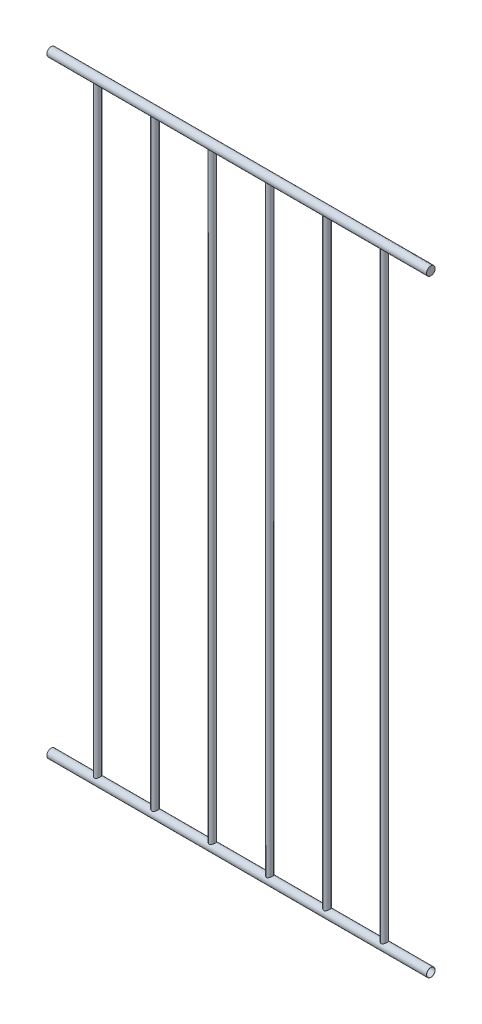
from build123d import *

# Parameters (mm, degrees)
SKETCH2_R                            = 11.45
BOSS_EXTRUDE1_DEPTH                  = 1000
BOSS_EXTRUDE1_2_DEPTH                = 1000
SKETCH3_R                            = 11
CUT_EXTRUDE1_DEPTH                   = 1000
BOSS_EXTRUDE3_REACH                  = 1289.867
BOSS_EXTRUDE3_END_RADIUS             = 11.45
SKETCH6_R                            = 8.072106602
BOSS_EXTRUDE3_DIRECTION_2_REACH      = 1289.867
BOSS_EXTRUDE3_DIRECTION_2_END_RADIUS = 11.45
BOSS_EXTRUDE4_REACH                  = 1289.867
SKETCH7_R                            = 7.5
BOSS_EXTRUDE4_DIRECTION_2_REACH      = 1289.867
SKETCH8_R                            = 11
CUT_EXTRUDE2_DEPTH                   = 1897.560736077
CUT_EXTRUDE4_REACH                   = 1289.867
SKETCH9_R                            = 7.5
CUT_EXTRUDE4_DIRECTION_2_REACH       = 1289.867
SKETCH10_R                           = 11
BOSS_EXTRUDE5_DEPTH                  = 2
SKETCH11_R                           = 11
BOSS_EXTRUDE6_DEPTH                  = 2


with BuildPart() as part:
    # Sketch2 → Boss-Extrude1 (new body)
    with BuildSketch(Plane(origin=(0, 0, 0), x_dir=(0, 0, -1), z_dir=(1, 0, 0))):
        Circle(SKETCH2_R)
    extrude(amount=BOSS_EXTRUDE1_DEPTH)


with BuildPart() as body_2:
    # Sketch2 → Boss-Extrude1 2 (new body)
    with BuildSketch(Plane(origin=(0, 0, 0), x_dir=(0, 0, -1), z_dir=(1, 0, 0))):
        with Locations((0, -1600.012541484)):
            Circle(SKETCH2_R)
    extrude(amount=BOSS_EXTRUDE1_2_DEPTH)


with BuildPart() as cut_extrude1_tool:
    # Sketch3 → Cut-Extrude1 (new body)
    with BuildSketch(Plane(origin=(0, 0, 0), x_dir=(0, 0, -1), z_dir=(1, 0, 0))):
        Circle(SKETCH3_R)
        with Locations((0, -1600)):
            Circle(SKETCH3_R)
    extrude(amount=CUT_EXTRUDE1_DEPTH)


with BuildPart() as part_1:
    add(part.part)

    # Cut-Extrude1: cut by cut_extrude1_tool
    add(cut_extrude1_tool.part, mode=Mode.SUBTRACT)



with BuildPart() as body_2_1:
    add(body_2.part)

    # Cut-Extrude1: cut by cut_extrude1_tool
    add(cut_extrude1_tool.part, mode=Mode.SUBTRACT)


with BuildPart() as part_2:
    add(part_1.part)

    add(body_2_1.part)  # Boss-Extrude3 merges body 2
    # Boss-Extrude3: up to this cylinder (the profile starts outside it)
    boss_extrude3_end = Plane(origin=(500, -1600.012541484, 0), z_dir=(-1, 0, 0)) * Cylinder(BOSS_EXTRUDE3_END_RADIUS, 3358.634, mode=Mode.PRIVATE)
    # Sketch6 → Boss-Extrude3 (add, up to the surface)
    with BuildSketch(Plane(origin=(0, -800, 0), x_dir=(-1, 0, 0), z_dir=(0, -1, 0)), mode=Mode.PRIVATE) as boss_extrude3_sk1:
        with Locations((-122.5, 0)):
            Circle(SKETCH6_R)
    boss_extrude3_tool1 = extrude(boss_extrude3_sk1.sketch, amount=BOSS_EXTRUDE3_REACH, mode=Mode.PRIVATE) - boss_extrude3_end
    add(boss_extrude3_tool1.solids().sort_by_distance((122.5, -800, 0))[0])
    # Sketch6 → Boss-Extrude3 (add, up to the surface)
    with BuildSketch(Plane(origin=(0, -800, 0), x_dir=(-1, 0, 0), z_dir=(0, -1, 0)), mode=Mode.PRIVATE) as boss_extrude3_sk2:
        with Locations((-273.5, 0)):
            Circle(SKETCH6_R)
    boss_extrude3_tool2 = extrude(boss_extrude3_sk2.sketch, amount=BOSS_EXTRUDE3_REACH, mode=Mode.PRIVATE) - boss_extrude3_end
    add(boss_extrude3_tool2.solids().sort_by_distance((273.5, -800, 0))[0])
    # Sketch6 → Boss-Extrude3 (add, up to the surface)
    with BuildSketch(Plane(origin=(0, -800, 0), x_dir=(-1, 0, 0), z_dir=(0, -1, 0)), mode=Mode.PRIVATE) as boss_extrude3_sk3:
        with Locations((-424.5, 0)):
            Circle(SKETCH6_R)
    boss_extrude3_tool3 = extrude(boss_extrude3_sk3.sketch, amount=BOSS_EXTRUDE3_REACH, mode=Mode.PRIVATE) - boss_extrude3_end
    add(boss_extrude3_tool3.solids().sort_by_distance((424.5, -800, 0))[0])
    # Sketch6 → Boss-Extrude3 (add, up to the surface)
    with BuildSketch(Plane(origin=(0, -800, 0), x_dir=(-1, 0, 0), z_dir=(0, -1, 0)), mode=Mode.PRIVATE) as boss_extrude3_sk4:
        with Locations((-575.5, 0)):
            Circle(SKETCH6_R)
    boss_extrude3_tool4 = extrude(boss_extrude3_sk4.sketch, amount=BOSS_EXTRUDE3_REACH, mode=Mode.PRIVATE) - boss_extrude3_end
    add(boss_extrude3_tool4.solids().sort_by_distance((575.5, -800, 0))[0])
    # Sketch6 → Boss-Extrude3 (add, up to the surface)
    with BuildSketch(Plane(origin=(0, -800, 0), x_dir=(-1, 0, 0), z_dir=(0, -1, 0)), mode=Mode.PRIVATE) as boss_extrude3_sk5:
        with Locations((-726.5, 0)):
            Circle(SKETCH6_R)
    boss_extrude3_tool5 = extrude(boss_extrude3_sk5.sketch, amount=BOSS_EXTRUDE3_REACH, mode=Mode.PRIVATE) - boss_extrude3_end
    add(boss_extrude3_tool5.solids().sort_by_distance((726.5, -800, 0))[0])
    # Sketch6 → Boss-Extrude3 (add, up to the surface)
    with BuildSketch(Plane(origin=(0, -800, 0), x_dir=(-1, 0, 0), z_dir=(0, -1, 0)), mode=Mode.PRIVATE) as boss_extrude3_sk6:
        with Locations((-877.5, 0)):
            Circle(SKETCH6_R)
    boss_extrude3_tool6 = extrude(boss_extrude3_sk6.sketch, amount=BOSS_EXTRUDE3_REACH, mode=Mode.PRIVATE) - boss_extrude3_end
    add(boss_extrude3_tool6.solids().sort_by_distance((877.5, -800, 0))[0])

    # Boss-Extrude3 direction 2: up to this cylinder (the profile starts outside it)
    boss_extrude3_direction_2_end = Plane(origin=(500, 0, 0), z_dir=(-1, 0, 0)) * Cylinder(BOSS_EXTRUDE3_DIRECTION_2_END_RADIUS, 3358.634, mode=Mode.PRIVATE)
    # Sketch6 → Boss-Extrude3 direction 2 (add, up to the surface)
    with BuildSketch(Plane(origin=(0, -800, 0), x_dir=(-1, 0, 0), z_dir=(0, -1, 0)), mode=Mode.PRIVATE) as boss_extrude3_direction_2_sk1:
        with Locations((-122.5, 0)):
            Circle(SKETCH6_R)
    boss_extrude3_direction_2_tool1 = extrude(boss_extrude3_direction_2_sk1.sketch, amount=-BOSS_EXTRUDE3_DIRECTION_2_REACH, mode=Mode.PRIVATE) - boss_extrude3_direction_2_end
    add(boss_extrude3_direction_2_tool1.solids().sort_by_distance((122.5, -800, 0))[0])
    # Sketch6 → Boss-Extrude3 direction 2 (add, up to the surface)
    with BuildSketch(Plane(origin=(0, -800, 0), x_dir=(-1, 0, 0), z_dir=(0, -1, 0)), mode=Mode.PRIVATE) as boss_extrude3_direction_2_sk2:
        with Locations((-273.5, 0)):
            Circle(SKETCH6_R)
    boss_extrude3_direction_2_tool2 = extrude(boss_extrude3_direction_2_sk2.sketch, amount=-BOSS_EXTRUDE3_DIRECTION_2_REACH, mode=Mode.PRIVATE) - boss_extrude3_direction_2_end
    add(boss_extrude3_direction_2_tool2.solids().sort_by_distance((273.5, -800, 0))[0])
    # Sketch6 → Boss-Extrude3 direction 2 (add, up to the surface)
    with BuildSketch(Plane(origin=(0, -800, 0), x_dir=(-1, 0, 0), z_dir=(0, -1, 0)), mode=Mode.PRIVATE) as boss_extrude3_direction_2_sk3:
        with Locations((-424.5, 0)):
            Circle(SKETCH6_R)
    boss_extrude3_direction_2_tool3 = extrude(boss_extrude3_direction_2_sk3.sketch, amount=-BOSS_EXTRUDE3_DIRECTION_2_REACH, mode=Mode.PRIVATE) - boss_extrude3_direction_2_end
    add(boss_extrude3_direction_2_tool3.solids().sort_by_distance((424.5, -800, 0))[0])
    # Sketch6 → Boss-Extrude3 direction 2 (add, up to the surface)
    with BuildSketch(Plane(origin=(0, -800, 0), x_dir=(-1, 0, 0), z_dir=(0, -1, 0)), mode=Mode.PRIVATE) as boss_extrude3_direction_2_sk4:
        with Locations((-575.5, 0)):
            Circle(SKETCH6_R)
    boss_extrude3_direction_2_tool4 = extrude(boss_extrude3_direction_2_sk4.sketch, amount=-BOSS_EXTRUDE3_DIRECTION_2_REACH, mode=Mode.PRIVATE) - boss_extrude3_direction_2_end
    add(boss_extrude3_direction_2_tool4.solids().sort_by_distance((575.5, -800, 0))[0])
    # Sketch6 → Boss-Extrude3 direction 2 (add, up to the surface)
    with BuildSketch(Plane(origin=(0, -800, 0), x_dir=(-1, 0, 0), z_dir=(0, -1, 0)), mode=Mode.PRIVATE) as boss_extrude3_direction_2_sk5:
        with Locations((-726.5, 0)):
            Circle(SKETCH6_R)
    boss_extrude3_direction_2_tool5 = extrude(boss_extrude3_direction_2_sk5.sketch, amount=-BOSS_EXTRUDE3_DIRECTION_2_REACH, mode=Mode.PRIVATE) - boss_extrude3_direction_2_end
    add(boss_extrude3_direction_2_tool5.solids().sort_by_distance((726.5, -800, 0))[0])
    # Sketch6 → Boss-Extrude3 direction 2 (add, up to the surface)
    with BuildSketch(Plane(origin=(0, -800, 0), x_dir=(-1, 0, 0), z_dir=(0, -1, 0)), mode=Mode.PRIVATE) as boss_extrude3_direction_2_sk6:
        with Locations((-877.5, 0)):
            Circle(SKETCH6_R)
    boss_extrude3_direction_2_tool6 = extrude(boss_extrude3_direction_2_sk6.sketch, amount=-BOSS_EXTRUDE3_DIRECTION_2_REACH, mode=Mode.PRIVATE) - boss_extrude3_direction_2_end
    add(boss_extrude3_direction_2_tool6.solids().sort_by_distance((877.5, -800, 0))[0])

    # Sketch7 → Boss-Extrude4 (add, up to next)
    with BuildSketch(Plane(origin=(0, -800, 0), x_dir=(-1, 0, 0), z_dir=(0, -1, 0)), mode=Mode.PRIVATE) as boss_extrude4_sk1:
        with Locations((-122.5, 0)):
            Circle(SKETCH7_R)
    boss_extrude4_tool1 = extrude(boss_extrude4_sk1.sketch, amount=BOSS_EXTRUDE4_REACH, mode=Mode.PRIVATE) - part_2.part
    # Sketch7 → Boss-Extrude4 (add, up to next)
    with BuildSketch(Plane(origin=(0, -800, 0), x_dir=(-1, 0, 0), z_dir=(0, -1, 0)), mode=Mode.PRIVATE) as boss_extrude4_sk2:
        with Locations((-273.5, 0)):
            Circle(SKETCH7_R)
    boss_extrude4_tool2 = extrude(boss_extrude4_sk2.sketch, amount=BOSS_EXTRUDE4_REACH, mode=Mode.PRIVATE) - part_2.part
    # Sketch7 → Boss-Extrude4 (add, up to next)
    with BuildSketch(Plane(origin=(0, -800, 0), x_dir=(-1, 0, 0), z_dir=(0, -1, 0)), mode=Mode.PRIVATE) as boss_extrude4_sk3:
        with Locations((-424.5, 0)):
            Circle(SKETCH7_R)
    boss_extrude4_tool3 = extrude(boss_extrude4_sk3.sketch, amount=BOSS_EXTRUDE4_REACH, mode=Mode.PRIVATE) - part_2.part
    # Sketch7 → Boss-Extrude4 (add, up to next)
    with BuildSketch(Plane(origin=(0, -800, 0), x_dir=(-1, 0, 0), z_dir=(0, -1, 0)), mode=Mode.PRIVATE) as boss_extrude4_sk4:
        with Locations((-575.5, 0)):
            Circle(SKETCH7_R)
    boss_extrude4_tool4 = extrude(boss_extrude4_sk4.sketch, amount=BOSS_EXTRUDE4_REACH, mode=Mode.PRIVATE) - part_2.part
    # Sketch7 → Boss-Extrude4 (add, up to next)
    with BuildSketch(Plane(origin=(0, -800, 0), x_dir=(-1, 0, 0), z_dir=(0, -1, 0)), mode=Mode.PRIVATE) as boss_extrude4_sk5:
        with Locations((-726.5, 0)):
            Circle(SKETCH7_R)
    boss_extrude4_tool5 = extrude(boss_extrude4_sk5.sketch, amount=BOSS_EXTRUDE4_REACH, mode=Mode.PRIVATE) - part_2.part
    # Sketch7 → Boss-Extrude4 (add, up to next)
    with BuildSketch(Plane(origin=(0, -800, 0), x_dir=(-1, 0, 0), z_dir=(0, -1, 0)), mode=Mode.PRIVATE) as boss_extrude4_sk6:
        with Locations((-877.5, 0)):
            Circle(SKETCH7_R)
    boss_extrude4_tool6 = extrude(boss_extrude4_sk6.sketch, amount=BOSS_EXTRUDE4_REACH, mode=Mode.PRIVATE) - part_2.part
    add(boss_extrude4_tool1.solids().sort_by_distance((122.5, -800, 0))[0])
    add(boss_extrude4_tool2.solids().sort_by_distance((273.5, -800, 0))[0])
    add(boss_extrude4_tool3.solids().sort_by_distance((424.5, -800, 0))[0])
    add(boss_extrude4_tool4.solids().sort_by_distance((575.5, -800, 0))[0])
    add(boss_extrude4_tool5.solids().sort_by_distance((726.5, -800, 0))[0])
    add(boss_extrude4_tool6.solids().sort_by_distance((877.5, -800, 0))[0])

    # Sketch7 → Boss-Extrude4 direction 2 (add, up to next)
    with BuildSketch(Plane(origin=(0, -800, 0), x_dir=(-1, 0, 0), z_dir=(0, -1, 0)), mode=Mode.PRIVATE) as boss_extrude4_direction_2_sk1:
        with Locations((-122.5, 0)):
            Circle(SKETCH7_R)
    boss_extrude4_direction_2_tool1 = extrude(boss_extrude4_direction_2_sk1.sketch, amount=-BOSS_EXTRUDE4_DIRECTION_2_REACH, mode=Mode.PRIVATE) - part_2.part
    # Sketch7 → Boss-Extrude4 direction 2 (add, up to next)
    with BuildSketch(Plane(origin=(0, -800, 0), x_dir=(-1, 0, 0), z_dir=(0, -1, 0)), mode=Mode.PRIVATE) as boss_extrude4_direction_2_sk2:
        with Locations((-273.5, 0)):
            Circle(SKETCH7_R)
    boss_extrude4_direction_2_tool2 = extrude(boss_extrude4_direction_2_sk2.sketch, amount=-BOSS_EXTRUDE4_DIRECTION_2_REACH, mode=Mode.PRIVATE) - part_2.part
    # Sketch7 → Boss-Extrude4 direction 2 (add, up to next)
    with BuildSketch(Plane(origin=(0, -800, 0), x_dir=(-1, 0, 0), z_dir=(0, -1, 0)), mode=Mode.PRIVATE) as boss_extrude4_direction_2_sk3:
        with Locations((-424.5, 0)):
            Circle(SKETCH7_R)
    boss_extrude4_direction_2_tool3 = extrude(boss_extrude4_direction_2_sk3.sketch, amount=-BOSS_EXTRUDE4_DIRECTION_2_REACH, mode=Mode.PRIVATE) - part_2.part
    # Sketch7 → Boss-Extrude4 direction 2 (add, up to next)
    with BuildSketch(Plane(origin=(0, -800, 0), x_dir=(-1, 0, 0), z_dir=(0, -1, 0)), mode=Mode.PRIVATE) as boss_extrude4_direction_2_sk4:
        with Locations((-575.5, 0)):
            Circle(SKETCH7_R)
    boss_extrude4_direction_2_tool4 = extrude(boss_extrude4_direction_2_sk4.sketch, amount=-BOSS_EXTRUDE4_DIRECTION_2_REACH, mode=Mode.PRIVATE) - part_2.part
    # Sketch7 → Boss-Extrude4 direction 2 (add, up to next)
    with BuildSketch(Plane(origin=(0, -800, 0), x_dir=(-1, 0, 0), z_dir=(0, -1, 0)), mode=Mode.PRIVATE) as boss_extrude4_direction_2_sk5:
        with Locations((-726.5, 0)):
            Circle(SKETCH7_R)
    boss_extrude4_direction_2_tool5 = extrude(boss_extrude4_direction_2_sk5.sketch, amount=-BOSS_EXTRUDE4_DIRECTION_2_REACH, mode=Mode.PRIVATE) - part_2.part
    # Sketch7 → Boss-Extrude4 direction 2 (add, up to next)
    with BuildSketch(Plane(origin=(0, -800, 0), x_dir=(-1, 0, 0), z_dir=(0, -1, 0)), mode=Mode.PRIVATE) as boss_extrude4_direction_2_sk6:
        with Locations((-877.5, 0)):
            Circle(SKETCH7_R)
    boss_extrude4_direction_2_tool6 = extrude(boss_extrude4_direction_2_sk6.sketch, amount=-BOSS_EXTRUDE4_DIRECTION_2_REACH, mode=Mode.PRIVATE) - part_2.part
    add(boss_extrude4_direction_2_tool1.solids().sort_by_distance((122.5, -800, 0))[0])
    add(boss_extrude4_direction_2_tool2.solids().sort_by_distance((273.5, -800, 0))[0])
    add(boss_extrude4_direction_2_tool3.solids().sort_by_distance((424.5, -800, 0))[0])
    add(boss_extrude4_direction_2_tool4.solids().sort_by_distance((575.5, -800, 0))[0])
    add(boss_extrude4_direction_2_tool5.solids().sort_by_distance((726.5, -800, 0))[0])
    add(boss_extrude4_direction_2_tool6.solids().sort_by_distance((877.5, -800, 0))[0])

    # Sketch8 → Cut-Extrude2 (cut, through all)
    with BuildSketch(Plane(origin=(0, 0, 0), x_dir=(0, 0, -1), z_dir=(1, 0, 0))):
        with Locations((0, -1600)):
            Circle(SKETCH8_R)
        Circle(SKETCH8_R)
    extrude(amount=CUT_EXTRUDE2_DEPTH, mode=Mode.SUBTRACT)

    # Sketch9 → Cut-Extrude4 (cut, up to next)
    with BuildSketch(Plane(origin=(0, -800, 0), x_dir=(-1, 0, 0), z_dir=(0, -1, 0)), mode=Mode.PRIVATE) as cut_extrude4_sk1:
        with Locations((-122.5, 0)):
            Circle(SKETCH9_R)
    cut_extrude4_tool1 = extrude(cut_extrude4_sk1.sketch, amount=-CUT_EXTRUDE4_REACH, mode=Mode.PRIVATE) & part_2.part
    # Sketch9 → Cut-Extrude4 (cut, up to next)
    with BuildSketch(Plane(origin=(0, -800, 0), x_dir=(-1, 0, 0), z_dir=(0, -1, 0)), mode=Mode.PRIVATE) as cut_extrude4_sk2:
        with Locations((-273.5, 0)):
            Circle(SKETCH9_R)
    cut_extrude4_tool2 = extrude(cut_extrude4_sk2.sketch, amount=-CUT_EXTRUDE4_REACH, mode=Mode.PRIVATE) & part_2.part
    # Sketch9 → Cut-Extrude4 (cut, up to next)
    with BuildSketch(Plane(origin=(0, -800, 0), x_dir=(-1, 0, 0), z_dir=(0, -1, 0)), mode=Mode.PRIVATE) as cut_extrude4_sk3:
        with Locations((-424.5, 0)):
            Circle(SKETCH9_R)
    cut_extrude4_tool3 = extrude(cut_extrude4_sk3.sketch, amount=-CUT_EXTRUDE4_REACH, mode=Mode.PRIVATE) & part_2.part
    # Sketch9 → Cut-Extrude4 (cut, up to next)
    with BuildSketch(Plane(origin=(0, -800, 0), x_dir=(-1, 0, 0), z_dir=(0, -1, 0)), mode=Mode.PRIVATE) as cut_extrude4_sk4:
        with Locations((-575.5, 0)):
            Circle(SKETCH9_R)
    cut_extrude4_tool4 = extrude(cut_extrude4_sk4.sketch, amount=-CUT_EXTRUDE4_REACH, mode=Mode.PRIVATE) & part_2.part
    # Sketch9 → Cut-Extrude4 (cut, up to next)
    with BuildSketch(Plane(origin=(0, -800, 0), x_dir=(-1, 0, 0), z_dir=(0, -1, 0)), mode=Mode.PRIVATE) as cut_extrude4_sk5:
        with Locations((-726.5, 0)):
            Circle(SKETCH9_R)
    cut_extrude4_tool5 = extrude(cut_extrude4_sk5.sketch, amount=-CUT_EXTRUDE4_REACH, mode=Mode.PRIVATE) & part_2.part
    # Sketch9 → Cut-Extrude4 (cut, up to next)
    with BuildSketch(Plane(origin=(0, -800, 0), x_dir=(-1, 0, 0), z_dir=(0, -1, 0)), mode=Mode.PRIVATE) as cut_extrude4_sk6:
        with Locations((-877.5, 0)):
            Circle(SKETCH9_R)
    cut_extrude4_tool6 = extrude(cut_extrude4_sk6.sketch, amount=-CUT_EXTRUDE4_REACH, mode=Mode.PRIVATE) & part_2.part
    add(cut_extrude4_tool1.solids().sort_by_distance((122.5, -800, 0))[0], mode=Mode.SUBTRACT)
    add(cut_extrude4_tool2.solids().sort_by_distance((273.5, -800, 0))[0], mode=Mode.SUBTRACT)
    add(cut_extrude4_tool3.solids().sort_by_distance((424.5, -800, 0))[0], mode=Mode.SUBTRACT)
    add(cut_extrude4_tool4.solids().sort_by_distance((575.5, -800, 0))[0], mode=Mode.SUBTRACT)
    add(cut_extrude4_tool5.solids().sort_by_distance((726.5, -800, 0))[0], mode=Mode.SUBTRACT)
    add(cut_extrude4_tool6.solids().sort_by_distance((877.5, -800, 0))[0], mode=Mode.SUBTRACT)

    # Sketch9 → Cut-Extrude4 direction 2 (cut, up to next)
    with BuildSketch(Plane(origin=(0, -800, 0), x_dir=(-1, 0, 0), z_dir=(0, -1, 0)), mode=Mode.PRIVATE) as cut_extrude4_direction_2_sk1:
        with Locations((-122.5, 0)):
            Circle(SKETCH9_R)
    cut_extrude4_direction_2_tool1 = extrude(cut_extrude4_direction_2_sk1.sketch, amount=CUT_EXTRUDE4_DIRECTION_2_REACH, mode=Mode.PRIVATE) & part_2.part
    # Sketch9 → Cut-Extrude4 direction 2 (cut, up to next)
    with BuildSketch(Plane(origin=(0, -800, 0), x_dir=(-1, 0, 0), z_dir=(0, -1, 0)), mode=Mode.PRIVATE) as cut_extrude4_direction_2_sk2:
        with Locations((-273.5, 0)):
            Circle(SKETCH9_R)
    cut_extrude4_direction_2_tool2 = extrude(cut_extrude4_direction_2_sk2.sketch, amount=CUT_EXTRUDE4_DIRECTION_2_REACH, mode=Mode.PRIVATE) & part_2.part
    # Sketch9 → Cut-Extrude4 direction 2 (cut, up to next)
    with BuildSketch(Plane(origin=(0, -800, 0), x_dir=(-1, 0, 0), z_dir=(0, -1, 0)), mode=Mode.PRIVATE) as cut_extrude4_direction_2_sk3:
        with Locations((-424.5, 0)):
            Circle(SKETCH9_R)
    cut_extrude4_direction_2_tool3 = extrude(cut_extrude4_direction_2_sk3.sketch, amount=CUT_EXTRUDE4_DIRECTION_2_REACH, mode=Mode.PRIVATE) & part_2.part
    # Sketch9 → Cut-Extrude4 direction 2 (cut, up to next)
    with BuildSketch(Plane(origin=(0, -800, 0), x_dir=(-1, 0, 0), z_dir=(0, -1, 0)), mode=Mode.PRIVATE) as cut_extrude4_direction_2_sk4:
        with Locations((-575.5, 0)):
            Circle(SKETCH9_R)
    cut_extrude4_direction_2_tool4 = extrude(cut_extrude4_direction_2_sk4.sketch, amount=CUT_EXTRUDE4_DIRECTION_2_REACH, mode=Mode.PRIVATE) & part_2.part
    # Sketch9 → Cut-Extrude4 direction 2 (cut, up to next)
    with BuildSketch(Plane(origin=(0, -800, 0), x_dir=(-1, 0, 0), z_dir=(0, -1, 0)), mode=Mode.PRIVATE) as cut_extrude4_direction_2_sk5:
        with Locations((-726.5, 0)):
            Circle(SKETCH9_R)
    cut_extrude4_direction_2_tool5 = extrude(cut_extrude4_direction_2_sk5.sketch, amount=CUT_EXTRUDE4_DIRECTION_2_REACH, mode=Mode.PRIVATE) & part_2.part
    # Sketch9 → Cut-Extrude4 direction 2 (cut, up to next)
    with BuildSketch(Plane(origin=(0, -800, 0), x_dir=(-1, 0, 0), z_dir=(0, -1, 0)), mode=Mode.PRIVATE) as cut_extrude4_direction_2_sk6:
        with Locations((-877.5, 0)):
            Circle(SKETCH9_R)
    cut_extrude4_direction_2_tool6 = extrude(cut_extrude4_direction_2_sk6.sketch, amount=CUT_EXTRUDE4_DIRECTION_2_REACH, mode=Mode.PRIVATE) & part_2.part
    add(cut_extrude4_direction_2_tool1.solids().sort_by_distance((122.5, -800, 0))[0], mode=Mode.SUBTRACT)
    add(cut_extrude4_direction_2_tool2.solids().sort_by_distance((273.5, -800, 0))[0], mode=Mode.SUBTRACT)
    add(cut_extrude4_direction_2_tool3.solids().sort_by_distance((424.5, -800, 0))[0], mode=Mode.SUBTRACT)
    add(cut_extrude4_direction_2_tool4.solids().sort_by_distance((575.5, -800, 0))[0], mode=Mode.SUBTRACT)
    add(cut_extrude4_direction_2_tool5.solids().sort_by_distance((726.5, -800, 0))[0], mode=Mode.SUBTRACT)
    add(cut_extrude4_direction_2_tool6.solids().sort_by_distance((877.5, -800, 0))[0], mode=Mode.SUBTRACT)


with BuildPart() as body_2_2:
    # Sketch10 → Boss-Extrude5 (new body)
    with BuildSketch(Plane(origin=(1000, 0, 0), x_dir=(0, 0, -1), z_dir=(1, 0, 0))):
        Circle(SKETCH10_R)
    extrude(amount=-BOSS_EXTRUDE5_DEPTH)


with BuildPart() as body_3:
    # Sketch11 → Boss-Extrude6 (new body)
    with BuildSketch(Plane.ZY):
        with Locations((0, -1600)):
            Circle(SKETCH11_R)
    extrude(amount=-BOSS_EXTRUDE6_DEPTH)


solid = Compound([part_2.part, body_2_2.part, body_3.part])
